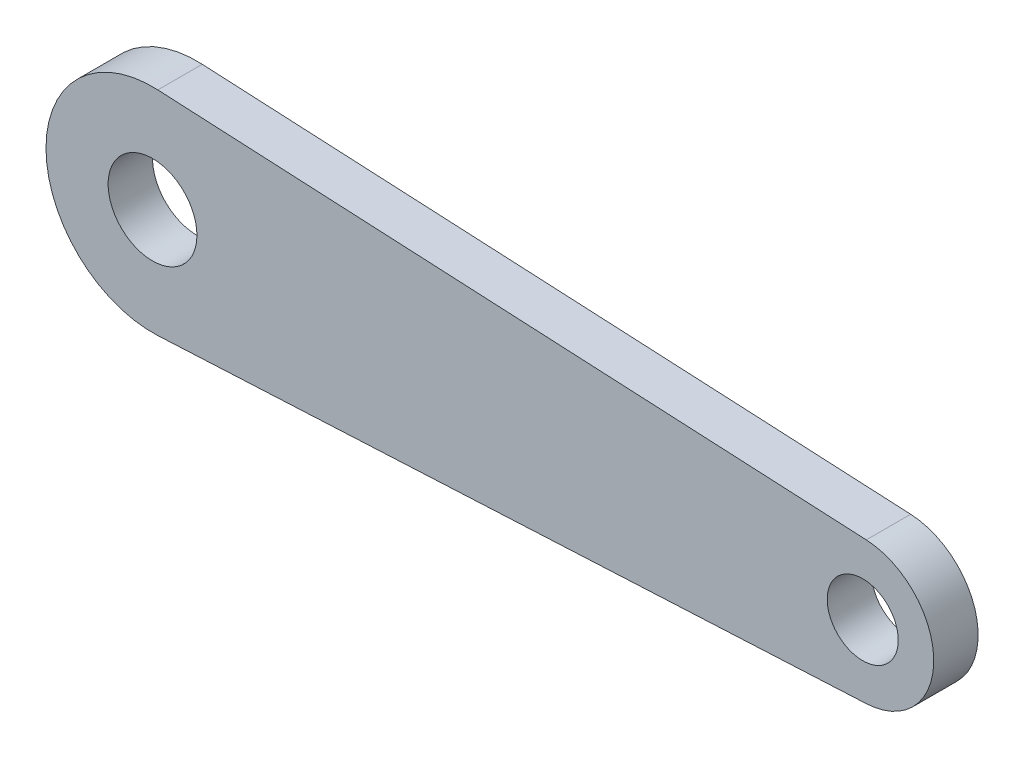
from build123d import *

# Parameters (mm, degrees)
SKETCH1_R           = 3.175
SKETCH1_R_2         = 2.54
BOSS_EXTRUDE1_DEPTH = 3.175


with BuildPart() as part:
    # Sketch1 → Boss-Extrude1 (new body)
    with BuildSketch(Plane.XY):
        with BuildLine():
            Line((0.381, 7.610469039), (51.054, 5.073646026))
            ThreePointArc((51.054, 5.073646026), (55.88, 0), (51.054, -5.073646026))
            Line((51.054, -5.073646026), (0.381, -7.610469039))
            ThreePointArc((0.381, -7.610469039), (-7.62, 0), (0.381, 7.610469039))
        make_face()
        Circle(SKETCH1_R, mode=Mode.SUBTRACT)
        with Locations((50.8, 0)):
            Circle(SKETCH1_R_2, mode=Mode.SUBTRACT)
    extrude(amount=BOSS_EXTRUDE1_DEPTH)


solid = part.part
